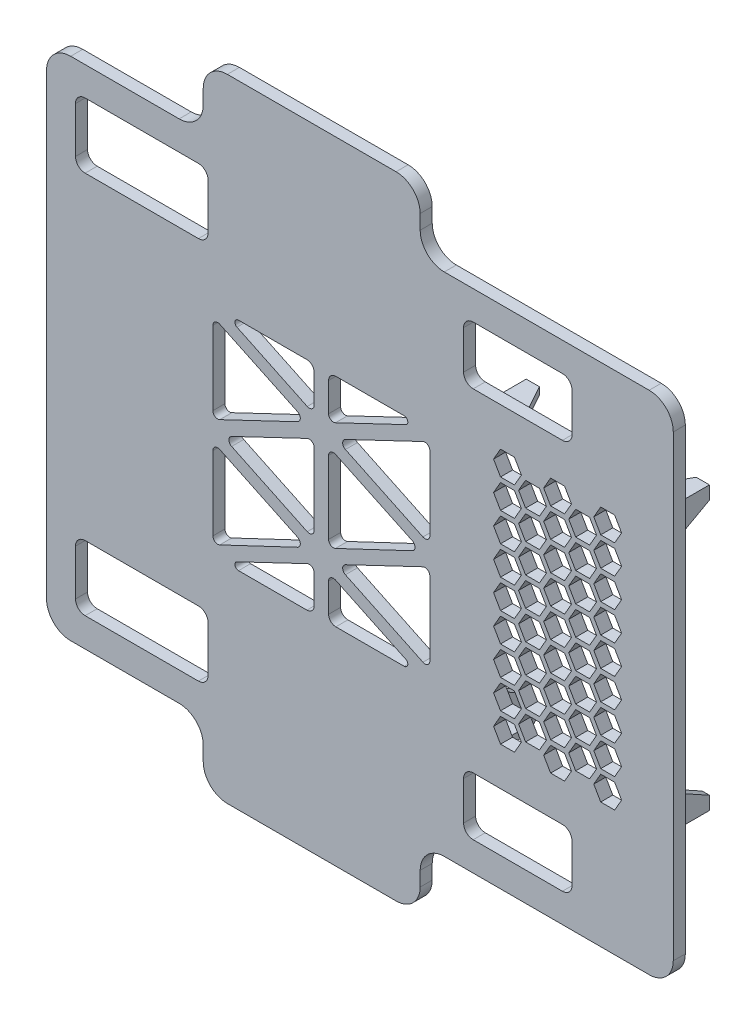
from build123d import *

# Parameters (mm, degrees)
EXTRUDE_1_DEPTH       = 5
EXTRUDE_2_DEPTH       = 20
CUT_EXTRUDE_3_DEPTH   = 10
CUT_EXTRUDE_4_DEPTH   = 10
MIRROR_2_COPY_1_DEPTH = 20
MIRROR_2_COPY_2_DEPTH = 10
MIRROR_2_COPY_3_DEPTH = 10
MIRROR_2_COPY_4_DEPTH = 20
MIRROR_2_COPY_5_DEPTH = 10
MIRROR_2_COPY_6_DEPTH = 10
CUT_EXTRUDE_5_DEPTH   = 5
SKETCH_9_W            = 55
SKETCH_9_H            = 27
SKETCH_9_W_2          = 45
SKETCH_9_H_2          = 24
CUT_EXTRUDE_6_DEPTH   = 5
FILLET_1_R            = 4
FILLET_2_R            = 1.5
FILLET_3_R            = 2
FILLET_4_R            = 3


with BuildPart() as part:
    # 草图1 → 凸台-拉伸1 (new body)
    with BuildSketch(Plane.XY):
        with BuildLine():
            Line((-130, 95), (-130, -95))
            ThreePointArc((-130, -95), (-127.071067812, -102.071067812), (-120, -105))
            Line((-120, -105), (-75, -105))
            ThreePointArc((-75, -105), (-67.928932188, -107.928932188), (-65, -115))
            Line((-65, -115), (-65, -121))
            ThreePointArc((-65, -121), (-62.071067812, -128.071067812), (-55, -131))
            Line((-55, -131), (15, -131))
            ThreePointArc((15, -131), (22.071067812, -128.071067812), (25, -121))
            Line((25, -121), (25, -115))
            ThreePointArc((25, -115), (27.928932188, -107.928932188), (35, -105))
            Line((35, -105), (120, -105))
            ThreePointArc((120, -105), (127.071067812, -102.071067812), (130, -95))
            Line((130, -95), (130, 95))
            ThreePointArc((130, 95), (127.071067812, 102.071067812), (120, 105))
            Line((120, 105), (35, 105))
            ThreePointArc((35, 105), (27.928932188, 107.928932188), (25, 115))
            Line((25, 115), (25, 121))
            ThreePointArc((25, 121), (22.071067812, 128.071067812), (15, 131))
            Line((15, 131), (-55, 131))
            ThreePointArc((-55, 131), (-62.071067812, 128.071067812), (-65, 121))
            Line((-65, 121), (-65, 115))
            ThreePointArc((-65, 115), (-67.928932188, 107.928932188), (-75, 105))
            Line((-75, 105), (-120, 105))
            ThreePointArc((-120, 105), (-127.071067812, 102.071067812), (-130, 95))
        make_face()
    extrude(amount=EXTRUDE_1_DEPTH)

    # 草图4 → 凸台-拉伸2 (add)
    with BuildSketch(Plane(origin=(0, 0, 0), x_dir=(-1, 0, 0), z_dir=(0, 0, -1))):
        Polygon((-44, -47.5), (-44, -58.5), (-55, -58.5), (-55, -55.5), (-47, -55.5), (-47, -47.5), align=None)
    extrude_2 = extrude(amount=EXTRUDE_2_DEPTH)

    # 草图5 → 切除-拉伸3 (cut)
    with BuildSketch(Plane.XZ.offset(58.5)):
        Polygon((55, -10), (49.5, -20), (55, -20), align=None)
    cut_extrude_3 = extrude(amount=-CUT_EXTRUDE_3_DEPTH, mode=Mode.SUBTRACT)

    # 草图6 → 切除-拉伸4 (cut)
    with BuildSketch(Plane.ZY.offset(-44)):
        Polygon((-20, -53), (-10, -47.5), (-20, -47.5), align=None)
    cut_extrude_4 = extrude(amount=-CUT_EXTRUDE_4_DEPTH, mode=Mode.SUBTRACT)

    # 镜向1: 凸台-拉伸2, 切除-拉伸3, 切除-拉伸4 across plane
    add(extrude_2.mirror(Plane(origin=(82, 0, 0), x_dir=(0, 0, 1), z_dir=(1, 0, 0))))
    add(cut_extrude_3.mirror(Plane(origin=(82, 0, 0), x_dir=(0, 0, 1), z_dir=(1, 0, 0))), mode=Mode.SUBTRACT)
    add(cut_extrude_4.mirror(Plane(origin=(82, 0, 0), x_dir=(0, 0, 1), z_dir=(1, 0, 0))), mode=Mode.SUBTRACT)

    # 镜向2 copy 1 sketch → 镜向2 copy 1 (add)
    with BuildSketch(Plane(origin=(164, 0, 0), x_dir=(1, 0, 0), z_dir=(0, 0, -1))):
        Polygon((-44, -47.5), (-44, -58.5), (-55, -58.5), (-55, -55.5), (-47, -55.5), (-47, -47.5), align=None)
    extrude(amount=MIRROR_2_COPY_1_DEPTH)

    # 镜向2 copy 2 sketch → 镜向2 copy 2 (cut)
    with BuildSketch(Plane(origin=(164, 58.5, 0), x_dir=(-1, 0, 0), z_dir=(0, 1, 0))):
        Polygon((55, -10), (49.5, -20), (55, -20), align=None)
    extrude(amount=-MIRROR_2_COPY_2_DEPTH, mode=Mode.SUBTRACT)

    # 镜向2 copy 3 sketch → 镜向2 copy 3 (cut)
    with BuildSketch(Plane(origin=(120, 0, 0), x_dir=(0, 0, 1), z_dir=(1, 0, 0))):
        Polygon((-20, -53), (-10, -47.5), (-20, -47.5), align=None)
    extrude(amount=-MIRROR_2_COPY_3_DEPTH, mode=Mode.SUBTRACT)

    # 镜向2 copy 4 sketch → 镜向2 copy 4 (add)
    with BuildSketch(Plane(origin=(0, 0, 0), x_dir=(-1, 0, 0), z_dir=(0, 0, -1))):
        Polygon((-44, 47.5), (-44, 58.5), (-55, 58.5), (-55, 55.5), (-47, 55.5), (-47, 47.5), align=None)
    extrude(amount=MIRROR_2_COPY_4_DEPTH)

    # 镜向2 copy 5 sketch → 镜向2 copy 5 (cut)
    with BuildSketch(Plane(origin=(0, 58.5, 0), x_dir=(1, 0, 0), z_dir=(0, 1, 0))):
        Polygon((55, 10), (49.5, 20), (55, 20), align=None)
    extrude(amount=-MIRROR_2_COPY_5_DEPTH, mode=Mode.SUBTRACT)

    # 镜向2 copy 6 sketch → 镜向2 copy 6 (cut)
    with BuildSketch(Plane.ZY.offset(-44)):
        Polygon((-20, 53), (-10, 47.5), (-20, 47.5), align=None)
    extrude(amount=-MIRROR_2_COPY_6_DEPTH, mode=Mode.SUBTRACT)

    # 草图7 → 切除-拉伸5 (cut)
    with BuildSketch(Plane(origin=(0, 0, 0), x_dir=(-1, 0, 0), z_dir=(0, 0, -1))):
        Polygon((-97.012994616, 36), (-99.899745962, 41), (-105.673248654, 41), (-108.56, 36), (-105.673248654, 31), (-99.899745962, 31), align=None)
        Polygon((-79.115136271, 31), (-76.228384925, 36), (-79.115136271, 41), (-84.888638963, 41), (-87.775390309, 36), (-84.888638963, 31), align=None)
        Polygon((-97.012994616, 24), (-99.899745962, 29), (-105.673248654, 29), (-108.56, 24), (-105.673248654, 19), (-99.899745962, 19), align=None)
        Polygon((-98.167695155, 30), (-95.280943809, 25), (-89.507441117, 25), (-86.620689771, 30), (-89.507441117, 35), (-95.280943809, 35), align=None)
        Polygon((-89.507441117, 37), (-86.620689771, 42), (-89.507441117, 47), (-95.280943809, 47), (-98.167695155, 42), (-95.280943809, 37), align=None)
        Polygon((-84.888638963, 43), (-79.115136271, 43), (-76.228384925, 48), (-79.115136271, 53), (-84.888638963, 53), (-87.775390309, 48), align=None)
        Polygon((-99.899745962, 43), (-97.012994616, 48), (-99.899745962, 53), (-105.673248654, 53), (-108.56, 48), (-105.673248654, 43), align=None)
        Polygon((-77.383085464, 42), (-74.496334118, 37), (-68.722831426, 37), (-65.83608008, 42), (-68.722831426, 47), (-74.496334118, 47), align=None)
        Polygon((-98.167695155, 18), (-95.280943809, 13), (-89.507441117, 13), (-86.620689771, 18), (-89.507441117, 23), (-95.280943809, 23), align=None)
        Polygon((-79.115136271, 19), (-76.228384925, 24), (-79.115136271, 29), (-84.888638963, 29), (-87.775390309, 24), (-84.888638963, 19), align=None)
        Polygon((-77.383085464, 30), (-74.496334118, 25), (-68.722831426, 25), (-65.83608008, 30), (-68.722831426, 35), (-74.496334118, 35), align=None)
        Polygon((-97.012994616, 12), (-99.899745962, 17), (-105.673248654, 17), (-108.56, 12), (-105.673248654, 7), (-99.899745962, 7), align=None)
        Polygon((-98.167695155, 6), (-95.280943809, 1), (-89.507441117, 1), (-86.620689771, 6), (-89.507441117, 11), (-95.280943809, 11), align=None)
        Polygon((-79.115136271, 7), (-76.228384925, 12), (-79.115136271, 17), (-84.888638963, 17), (-87.775390309, 12), (-84.888638963, 7), align=None)
        Polygon((-77.383085464, 18), (-74.496334118, 13), (-68.722831426, 13), (-65.83608008, 18), (-68.722831426, 23), (-74.496334118, 23), align=None)
        Polygon((-97.012994616, 0), (-99.899745962, 5), (-105.673248654, 5), (-108.56, 0), (-105.673248654, -5), (-99.899745962, -5), align=None)
        Polygon((-98.167695155, -6), (-95.280943809, -11), (-89.507441117, -11), (-86.620689771, -6), (-89.507441117, -1), (-95.280943809, -1), align=None)
        Polygon((-79.115136271, -5), (-76.228384925, 0), (-79.115136271, 5), (-84.888638963, 5), (-87.775390309, 0), (-84.888638963, -5), align=None)
        Polygon((-77.383085464, 6), (-74.496334118, 1), (-68.722831426, 1), (-65.83608008, 6), (-68.722831426, 11), (-74.496334118, 11), align=None)
        Polygon((-97.012994616, -12), (-99.899745962, -7), (-105.673248654, -7), (-108.56, -12), (-105.673248654, -17), (-99.899745962, -17), align=None)
        Polygon((-98.167695155, -18), (-95.280943809, -23), (-89.507441117, -23), (-86.620689771, -18), (-89.507441117, -13), (-95.280943809, -13), align=None)
        Polygon((-79.115136271, -17), (-76.228384925, -12), (-79.115136271, -7), (-84.888638963, -7), (-87.775390309, -12), (-84.888638963, -17), align=None)
        Polygon((-77.383085464, -6), (-74.496334118, -11), (-68.722831426, -11), (-65.83608008, -6), (-68.722831426, -1), (-74.496334118, -1), align=None)
        Polygon((-97.012994616, -24), (-99.899745962, -19), (-105.673248654, -19), (-108.56, -24), (-105.673248654, -29), (-99.899745962, -29), align=None)
        Polygon((-98.167695155, -30), (-95.280943809, -35), (-89.507441117, -35), (-86.620689771, -30), (-89.507441117, -25), (-95.280943809, -25), align=None)
        Polygon((-79.115136271, -29), (-76.228384925, -24), (-79.115136271, -19), (-84.888638963, -19), (-87.775390309, -24), (-84.888638963, -29), align=None)
        Polygon((-77.383085464, -18), (-74.496334118, -23), (-68.722831426, -23), (-65.83608008, -18), (-68.722831426, -13), (-74.496334118, -13), align=None)
        Polygon((-97.012994616, -36), (-99.899745962, -31), (-105.673248654, -31), (-108.56, -36), (-105.673248654, -41), (-99.899745962, -41), align=None)
        Polygon((-98.167695155, -42), (-95.280943809, -47), (-89.507441117, -47), (-86.620689771, -42), (-89.507441117, -37), (-95.280943809, -37), align=None)
        Polygon((-79.115136271, -41), (-76.228384925, -36), (-79.115136271, -31), (-84.888638963, -31), (-87.775390309, -36), (-84.888638963, -41), align=None)
        Polygon((-77.383085464, -30), (-74.496334118, -35), (-68.722831426, -35), (-65.83608008, -30), (-68.722831426, -25), (-74.496334118, -25), align=None)
        Polygon((-97.012994616, -48), (-99.899745962, -43), (-105.673248654, -43), (-108.56, -48), (-105.673248654, -53), (-99.899745962, -53), align=None)
        Polygon((-79.115136271, -53), (-76.228384925, -48), (-79.115136271, -43), (-84.888638963, -43), (-87.775390309, -48), (-84.888638963, -53), align=None)
        Polygon((-77.383085464, -42), (-74.496334118, -47), (-68.722831426, -47), (-65.83608008, -42), (-68.722831426, -37), (-74.496334118, -37), align=None)
        Polygon((-66.990780618, 36), (-64.104029272, 31), (-58.330526581, 31), (-55.443775235, 36), (-58.330526581, 41), (-64.104029272, 41), align=None)
        Polygon((-66.990780618, 48), (-64.104029272, 43), (-58.330526581, 43), (-55.443775235, 48), (-58.330526581, 53), (-64.104029272, 53), align=None)
        Polygon((-66.990780618, 24), (-64.104029272, 19), (-58.330526581, 19), (-55.443775235, 24), (-58.330526581, 29), (-64.104029272, 29), align=None)
        Polygon((-66.990780618, 12), (-64.104029272, 7), (-58.330526581, 7), (-55.443775235, 12), (-58.330526581, 17), (-64.104029272, 17), align=None)
        Polygon((-66.990780618, 0), (-64.104029272, -5), (-58.330526581, -5), (-55.443775235, 0), (-58.330526581, 5), (-64.104029272, 5), align=None)
        Polygon((-66.990780618, -12), (-64.104029272, -17), (-58.330526581, -17), (-55.443775235, -12), (-58.330526581, -7), (-64.104029272, -7), align=None)
        Polygon((-66.990780618, -24), (-64.104029272, -29), (-58.330526581, -29), (-55.443775235, -24), (-58.330526581, -19), (-64.104029272, -19), align=None)
        Polygon((-66.990780618, -36), (-64.104029272, -41), (-58.330526581, -41), (-55.443775235, -36), (-58.330526581, -31), (-64.104029272, -31), align=None)
        Polygon((-66.990780618, -48), (-64.104029272, -53), (-58.330526581, -53), (-55.443775235, -48), (-58.330526581, -43), (-64.104029272, -43), align=None)
    extrude(amount=-CUT_EXTRUDE_5_DEPTH, mode=Mode.SUBTRACT)

    # 草图9 → 切除-拉伸6 (cut)
    with BuildSketch(Plane(origin=(0, 0, 0), x_dir=(-1, 0, 0), z_dir=(0, 0, -1))):
        Polygon((9.804878049, 22.5), (-29, 41), (-29, 4), align=None)
        Polygon((13, -26.88372093), (-25, -45), (13, -45), align=None)
        Polygon((22.074593576, -22.557461202), (61, -41), (61, -4), align=None)
        Polygon((19, 26.88372093), (57, 45), (19, 45), align=None)
        Polygon((19, -18.11627907), (57, 0), (19, 18.11627907), align=None)
        with Locations((90.5, 79.5)):
            Rectangle(SKETCH_9_W, SKETCH_9_H)
        with Locations((90.5, -79.5)):
            Rectangle(SKETCH_9_W, SKETCH_9_H)
        with Locations((-65.5, 81)):
            Rectangle(SKETCH_9_W_2, SKETCH_9_H_2)
        with Locations((-65.5, -81)):
            Rectangle(SKETCH_9_W_2, SKETCH_9_H_2)
        Polygon((13, 45), (-25, 45), (13, 26.88372093), align=None)
        Polygon((61, 4), (61, 41), (22.074593576, 22.557461202), align=None)
        Polygon((13, 18.257993079), (-25.535898385, 0), (13, -18.257993079), align=None)
        Polygon((19, -45), (57, -45), (19, -26.88372093), align=None)
        Polygon((-29, -41), (9.804878049, -22.5), (-29, -4), align=None)
    extrude(amount=-CUT_EXTRUDE_6_DEPTH, mode=Mode.SUBTRACT)

    # 圆角1
    fillet_1_edges = [part.edges().sort_by_distance(p)[0] for p in [
        (-63, -93, 2.5),
        (-63, -66, 2.5),
        (-118, -93, 2.5),
        (-118, -66, 2.5),
        (-63, 66, 2.5),
        (-118, 66, 2.5),
        (-118, 93, 2.5),
        (-63, 93, 2.5),
        (43, -93, 2.5),
        (88, -69, 2.5),
        (43, -69, 2.5),
        (88, -93, 2.5),
        (88, 69, 2.5),
        (43, 69, 2.5),
        (43, 93, 2.5),
        (88, 93, 2.5),
    ]]
    fillet(fillet_1_edges, radius=FILLET_1_R)

    # 圆角2
    fillet_2_edges = [part.edges().sort_by_distance(p)[0] for p in [
        (25, -45, 2.5),
        (-57, -45, 2.5),
        (25, 45, 2.5),
        (-57, 45, 2.5),
    ]]
    fillet(fillet_2_edges, radius=FILLET_2_R)

    # 圆角3
    fillet_3_edges = [part.edges().sort_by_distance(p)[0] for p in [
        (29, -4, 2.5),
        (29, 4, 2.5),
        (-13, -18.257993079, 2.5),
        (-61, -41, 2.5),
        (-61, 4, 2.5),
        (-13, -26.88372093, 2.5),
        (-13, 18.257993079, 2.5),
        (-61, -4, 2.5),
        (-22.074593576, -22.557461202, 2.5),
        (25.535898385, 0, 2.5),
        (-22.074593576, 22.557461202, 2.5),
        (-61, 41, 2.5),
        (-19, 26.88372093, 2.5),
        (-19, -26.88372093, 2.5),
        (-19, -18.11627907, 2.5),
        (29, -41, 2.5),
        (29, 41, 2.5),
        (-57, 0, 2.5),
        (-9.804878049, -22.5, 2.5),
        (-13, 26.88372093, 2.5),
        (-9.804878049, 22.5, 2.5),
        (-19, 18.11627907, 2.5),
    ]]
    fillet(fillet_3_edges, radius=FILLET_3_R)

    # 圆角4
    fillet_4_edges = [part.edges().sort_by_distance(p)[0] for p in [
        (-13, -45, 2.5),
        (-13, 45, 2.5),
        (-19, -45, 2.5),
        (-19, 45, 2.5),
    ]]
    fillet(fillet_4_edges, radius=FILLET_4_R)


solid = part.part
